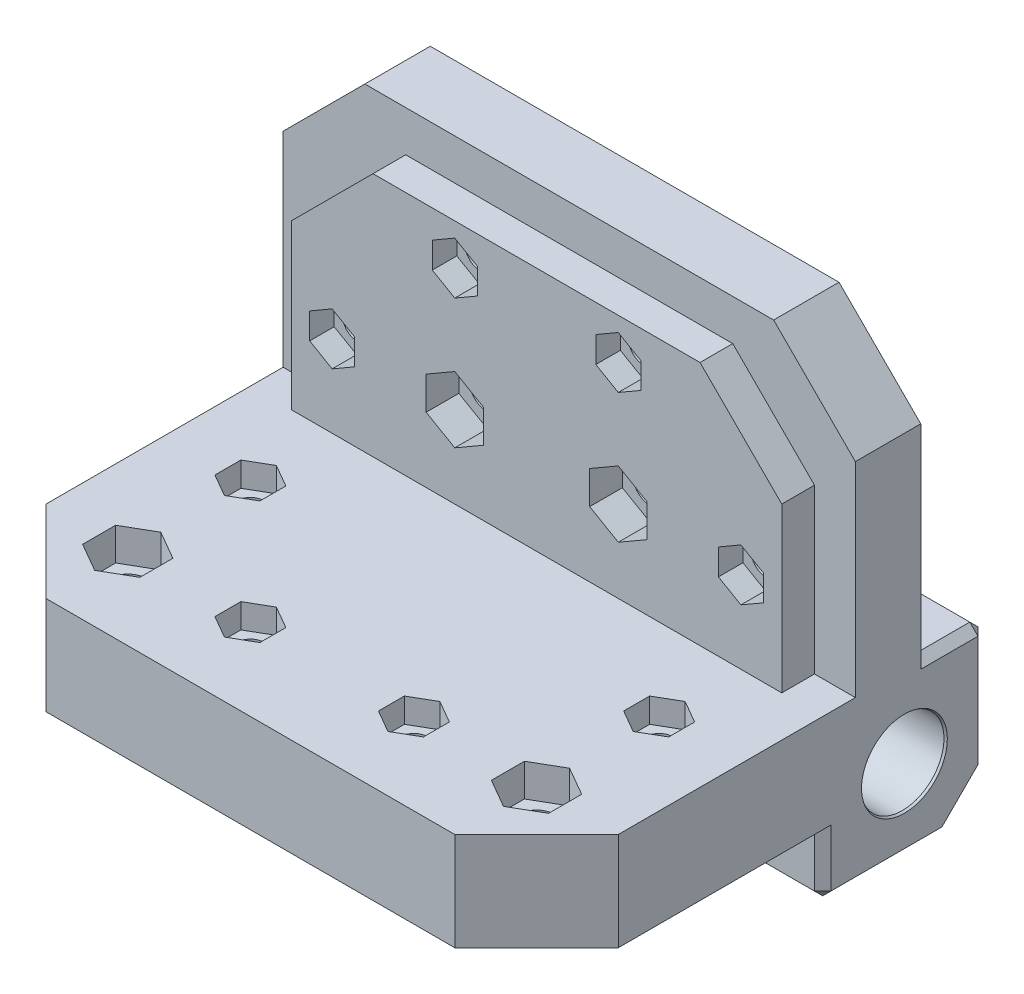
from build123d import *

# Parameters (mm, degrees)
BODY_DEPTH                             = 70
FRONTAL_M3_NUT_CUTOUTS_DEPTH           = 3
FRONTAL_M4_NUT_CUTOUT_DEPTH            = 4
MAIN_CHAMFER_SIZE                      = 5
SIDE_CHAMFER_SIZE                      = 1
WALL_CHAMFERS_SIZE                     = 10
CLEARANCE_CUTOUT_DEPTH                 = 4
M3_FULL_MIRROR_COPY_3_DEPTH            = 3
BOTTOM_BOARD_MOUNTING_HOLE_D           = 4.5
BOTTOM_BOARD_MOUNTING_HOLE_CBORE_D     = 8
BOTTOM_BOARD_MOUNTING_HOLE_CBORE_DEPTH = 4.4
BOTTOM_M4_NUT_CUTOUT_DEPTH             = 4


# Read off the part's stored shape, not the designer's step: hull_mounting_holes
with BuildPart() as part:
    # body_sketch → body (new body)
    with BuildSketch(Plane(origin=(0, 0, 0), x_dir=(0, 0, -1), z_dir=(1, 0, 0))):
        Polygon((0, 0), (0, 20), (-8, 20), (-8, 55), (-20, 55), (-20, 20), (-55, 20), (-55, 8), (-20, 8), (-20, 0), align=None)
    extrude(amount=BODY_DEPTH)

    # rod_hole_sketch_auto → rod_hole_d10 (revolve, cut)
    with BuildSketch(Plane(origin=(70, 10, 10), x_dir=(0, 0, -1), z_dir=(0, 1, 0))):
        Polygon((0, 0), (0, 70), (5.25, 70), (5.1, 69.740192379), (5.1, 0.259807621), (5.25, 0), align=None)
    revolve(axis=Axis((76.35, 10, 10), (-1, 0, 0)), mode=Mode.SUBTRACT)

    # hull_mounting_holes outline → hull_mounting_holes (revolve, cut)
    with BuildSketch(Plane(origin=(25, 45, 0), x_dir=(1, 0, 0), z_dir=(0, -1, 0))):
        Polygon((0, 8), (1.8, 8), (1.7, 8.1), (1.7, 19.9), (1.8, 20), (0, 20), align=None)
    hull_mounting_holes = revolve(axis=Axis((25, 45, 0), (0, 0, 1)), mode=Mode.SUBTRACT)

    # hull_mounting_holes 2 outline → hull_mounting_holes 2 (revolve, cut)
    with BuildSketch(Plane(origin=(10, 30, 0), x_dir=(1, 0, 0), z_dir=(0, -1, 0))):
        Polygon((0, 8), (1.8, 8), (1.7, 8.1), (1.7, 19.9), (1.8, 20), (0, 20), align=None)
    hull_mounting_holes_2 = revolve(axis=Axis((10, 30, 0), (0, 0, 1)), mode=Mode.SUBTRACT)

    # Sketch8 → board_mounting_hole (revolve, cut)
    with BuildSketch(Plane(origin=(25, 30, 8), x_dir=(0, 1, 0), z_dir=(1, 0, 0))):
        Polygon((0, 0), (0, 12), (2.275, 12), (2.25, 11.975), (2.25, 4.4), (4, 4.4), (4, 0.025), (4.025, 0), align=None)
    board_mounting_hole = revolve(axis=Axis((25, 30, 1.65), (0, 0, 1)), mode=Mode.SUBTRACT)

    # Sketch9 → frontal_m3_nut_cutouts (cut)
    with BuildSketch(Plane.XY.offset(20)):
        Polygon((25, 48.175426481), (22.25, 46.58771324), (22.25, 43.41228676), (25, 41.824573519), (27.75, 43.41228676), (27.75, 46.58771324), align=None)
        Polygon((10, 33.175426481), (7.25, 31.58771324), (7.25, 28.41228676), (10, 26.824573519), (12.75, 28.41228676), (12.75, 31.58771324), align=None)
    frontal_m3_nut_cutouts = extrude(amount=-FRONTAL_M3_NUT_CUTOUTS_DEPTH, mode=Mode.SUBTRACT)

    # Sketch10 → frontal_m4_nut_cutout (cut)
    with BuildSketch(Plane.XY.offset(20)):
        Polygon((21.5, 32.020725942), (21.5, 27.979274058), (25, 25.958548116), (28.5, 27.979274058), (28.5, 32.020725942), (25, 34.041451884), align=None)
    frontal_m4_nut_cutout = extrude(amount=-FRONTAL_M4_NUT_CUTOUT_DEPTH, mode=Mode.SUBTRACT)

    # frontal_m4_mirror: board_mounting_hole, frontal_m4_nut_cutout across plane
    add(board_mounting_hole.mirror(Plane.ZY.offset(-35)), mode=Mode.SUBTRACT)
    add(frontal_m4_nut_cutout.mirror(Plane.ZY.offset(-35)), mode=Mode.SUBTRACT)

    # main_chamfer
    main_chamfer_edges = [part.edges().sort_by_distance(p)[0] for p in [
        (35, 0, 0),
    ]]
    chamfer(main_chamfer_edges, length=MAIN_CHAMFER_SIZE)

    # side_chamfer
    side_chamfer_edges = [part.edges().sort_by_distance(p)[0] for p in [
        (0, 4, 20),
        (70, 20, 4),
        (0, 20, 4),
        (0, 0, 12.5),
        (0, 12.5, 0),
        (70, 12.5, 0),
        (0, 2.5, 2.5),
        (70, 2.5, 2.5),
        (35, 0, 20),
        (35, 20, 0),
        (70, 4, 20),
        (70, 0, 12.5),
    ]]
    chamfer(side_chamfer_edges, length=SIDE_CHAMFER_SIZE)

    # wall_chamfers
    wall_chamfers_edges = [part.edges().sort_by_distance(p)[0] for p in [
        (0, 14, 55),
        (0, 55, 14),
        (70, 55, 14),
        (70, 14, 55),
    ]]
    chamfer(wall_chamfers_edges, length=WALL_CHAMFERS_SIZE)

    # Sketch11 → clearance_cutout (cut)
    with BuildSketch(Plane.XY.offset(20)):
        Polygon((0, 20), (5, 20), (5, 40), (15, 50), (55, 50), (65, 40), (65, 20), (70, 20), (70, 45), (60, 55), (10, 55), (0, 45), align=None)
    extrude(amount=-CLEARANCE_CUTOUT_DEPTH, mode=Mode.SUBTRACT)

    # bottom_m3_mirror: hull_mounting_holes, hull_mounting_holes 2, frontal_m3_nut_cutouts across plane
    add(hull_mounting_holes.mirror(Plane(origin=(0, 0, 0), x_dir=(0, 0.7071067811865476, 0.7071067811865475), z_dir=(0, 0.7071067811865475, -0.7071067811865476))), mode=Mode.SUBTRACT)
    add(hull_mounting_holes_2.mirror(Plane(origin=(0, 0, 0), x_dir=(0, 0.7071067811865476, 0.7071067811865475), z_dir=(0, 0.7071067811865475, -0.7071067811865476))), mode=Mode.SUBTRACT)
    add(frontal_m3_nut_cutouts.mirror(Plane(origin=(0, 0, 0), x_dir=(0, 0.7071067811865476, 0.7071067811865475), z_dir=(0, 0.7071067811865475, -0.7071067811865476))), mode=Mode.SUBTRACT)

    # m3_full_mirror: hull_mounting_holes, hull_mounting_holes 2, frontal_m3_nut_cutouts across plane
    add(hull_mounting_holes.mirror(Plane.ZY.offset(-35)), mode=Mode.SUBTRACT)
    add(hull_mounting_holes_2.mirror(Plane.ZY.offset(-35)), mode=Mode.SUBTRACT)
    add(frontal_m3_nut_cutouts.mirror(Plane.ZY.offset(-35)), mode=Mode.SUBTRACT)

    # m3_full_mirror copy 1 sketch → m3_full_mirror copy 1 (revolve, cut)
    with BuildSketch(Plane(origin=(45, 0, 45), x_dir=(-1, 0, 0), z_dir=(0, 0, -1))):
        Polygon((0, 8), (1.8, 8), (1.7, 8.1), (1.7, 19.9), (1.8, 20), (0, 20), align=None)
    revolve(axis=Axis((45, 0, 45), (0, 1, 0)), mode=Mode.SUBTRACT)

    # m3_full_mirror copy 2 sketch → m3_full_mirror copy 2 (revolve, cut)
    with BuildSketch(Plane(origin=(60, 0, 30), x_dir=(-1, 0, 0), z_dir=(0, 0, -1))):
        Polygon((0, 8), (1.8, 8), (1.7, 8.1), (1.7, 19.9), (1.8, 20), (0, 20), align=None)
    revolve(axis=Axis((60, 0, 30), (0, 1, 0)), mode=Mode.SUBTRACT)

    # m3_full_mirror copy 3 sketch → m3_full_mirror copy 3 (cut)
    with BuildSketch(Plane(origin=(70, 20, 0), x_dir=(-1, 0, 0), z_dir=(0, 1, 0))):
        Polygon((25, 48.175426481), (22.25, 46.58771324), (22.25, 43.41228676), (25, 41.824573519), (27.75, 43.41228676), (27.75, 46.58771324), align=None)
        Polygon((10, 33.175426481), (7.25, 31.58771324), (7.25, 28.41228676), (10, 26.824573519), (12.75, 28.41228676), (12.75, 31.58771324), align=None)
    extrude(amount=-M3_FULL_MIRROR_COPY_3_DEPTH, mode=Mode.SUBTRACT)

    # m3_full_mirror copy 4 sketch → m3_full_mirror copy 4 (revolve, cut)
    with BuildSketch(Plane(origin=(60, 30, 0), x_dir=(-1, 0, 0), z_dir=(0, -1, 0))):
        Polygon((0, -8), (1.8, -8), (1.7, -8.1), (1.7, -19.9), (1.8, -20), (0, -20), align=None)
    revolve(axis=Axis((60, 30, 0), (0, 0, -1)), mode=Mode.SUBTRACT)

    # bottom_board_mounting_hole (through all)
    with Locations(Plane.XZ.offset(-8)):
        with Locations((10, 45)):
            bottom_board_mounting_hole = CounterBoreHole(BOTTOM_BOARD_MOUNTING_HOLE_D / 2, BOTTOM_BOARD_MOUNTING_HOLE_CBORE_D / 2, BOTTOM_BOARD_MOUNTING_HOLE_CBORE_DEPTH)

    # Sketch15 → bottom_m4_nut_cutout (cut)
    with BuildSketch(Plane(origin=(0, 20, 0), x_dir=(1, 0, 0), z_dir=(0, 1, 0))):
        Polygon((10, -40.958548116), (6.5, -42.979274058), (6.5, -47.020725942), (10, -49.041451884), (13.5, -47.020725942), (13.5, -42.979274058), align=None)
    bottom_m4_nut_cutout = extrude(amount=-BOTTOM_M4_NUT_CUTOUT_DEPTH, mode=Mode.SUBTRACT)

    # bottom_m4_mirror: bottom_board_mounting_hole, bottom_m4_nut_cutout across plane
    add(bottom_board_mounting_hole.mirror(Plane.ZY.offset(-35)), mode=Mode.SUBTRACT)
    add(bottom_m4_nut_cutout.mirror(Plane.ZY.offset(-35)), mode=Mode.SUBTRACT)


solid = part.part
